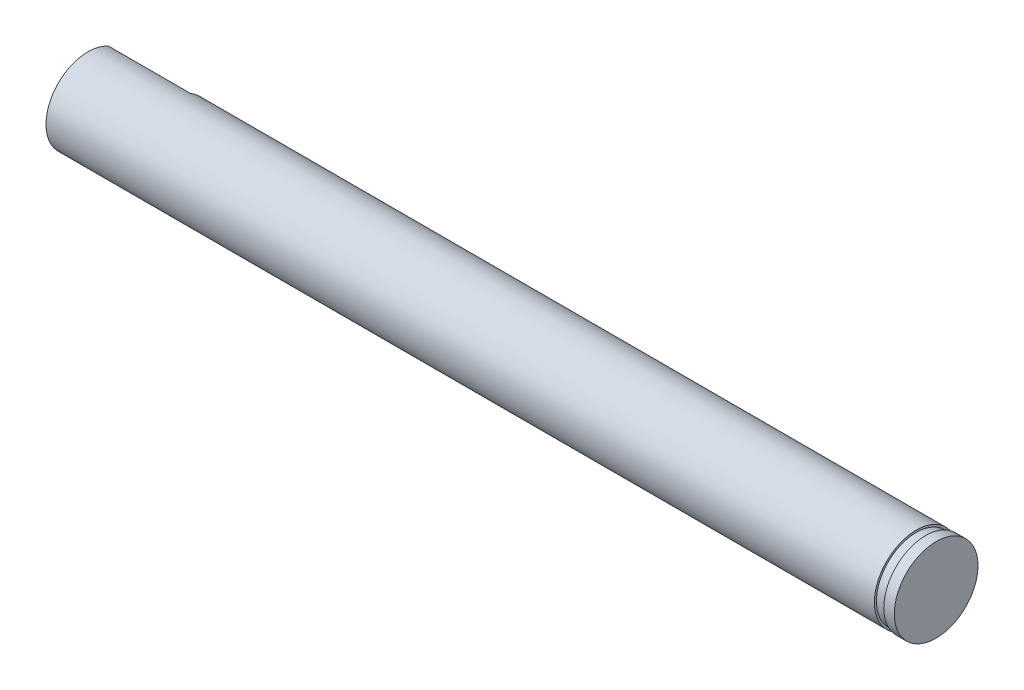
from build123d import *

# Parameters (mm, degrees)
BOSS_EXTRUDE1_DEPTH = 7.8
SKETCH2_R           = 3.995
BOSS_EXTRUDE2_DEPTH = 73.146
CUT_EXTRUDE1_START  = -1
SKETCH3_R           = 5
SKETCH3_R_2         = 3.8
CUT_EXTRUDE1_DEPTH  = 0.9


with BuildPart() as part:
    # Sketch1 → Boss-Extrude1 (new body)
    with BuildSketch(Plane(origin=(0, 0, 0), x_dir=(0, 0, -1), z_dir=(1, 0, 0))):
        with BuildLine():
            Line((1.985, 3.466958321), (1.985, -3.466958321))
            ThreePointArc((1.985, -3.466958321), (-3.995, 0), (1.985, 3.466958321))
        make_face()
    extrude(amount=BOSS_EXTRUDE1_DEPTH)

    # Sketch2 → Boss-Extrude2 (add)
    with BuildSketch(Plane(origin=(7.8, 0, 0), x_dir=(0, 0, -1), z_dir=(1, 0, 0))):
        Circle(SKETCH2_R)
    extrude(amount=BOSS_EXTRUDE2_DEPTH)

    # Sketch3 → Cut-Extrude1 (cut)
    with BuildSketch(Plane(origin=(80.946, 0, 0), x_dir=(0, 0, -1), z_dir=(1, 0, 0)).offset(CUT_EXTRUDE1_START)):
        Circle(SKETCH3_R)
        Circle(SKETCH3_R_2, mode=Mode.SUBTRACT)
    extrude(amount=-CUT_EXTRUDE1_DEPTH, mode=Mode.SUBTRACT)

    # Cut-Extrude2 cone 1 section (through the dimple's axis) → Cut-Extrude2 (revolve, cut)
    with BuildSketch(Plane(origin=(43.434, 0, -3.995), x_dir=(0, 1, 0), z_dir=(1, 0, 0))):
        Polygon((0, 0), (1.778, 0), (0, 1.778), align=None)
    revolve(axis=Axis((43.434, 0, -3.995), (0, 0, 1)), mode=Mode.SUBTRACT)


solid = part.part
